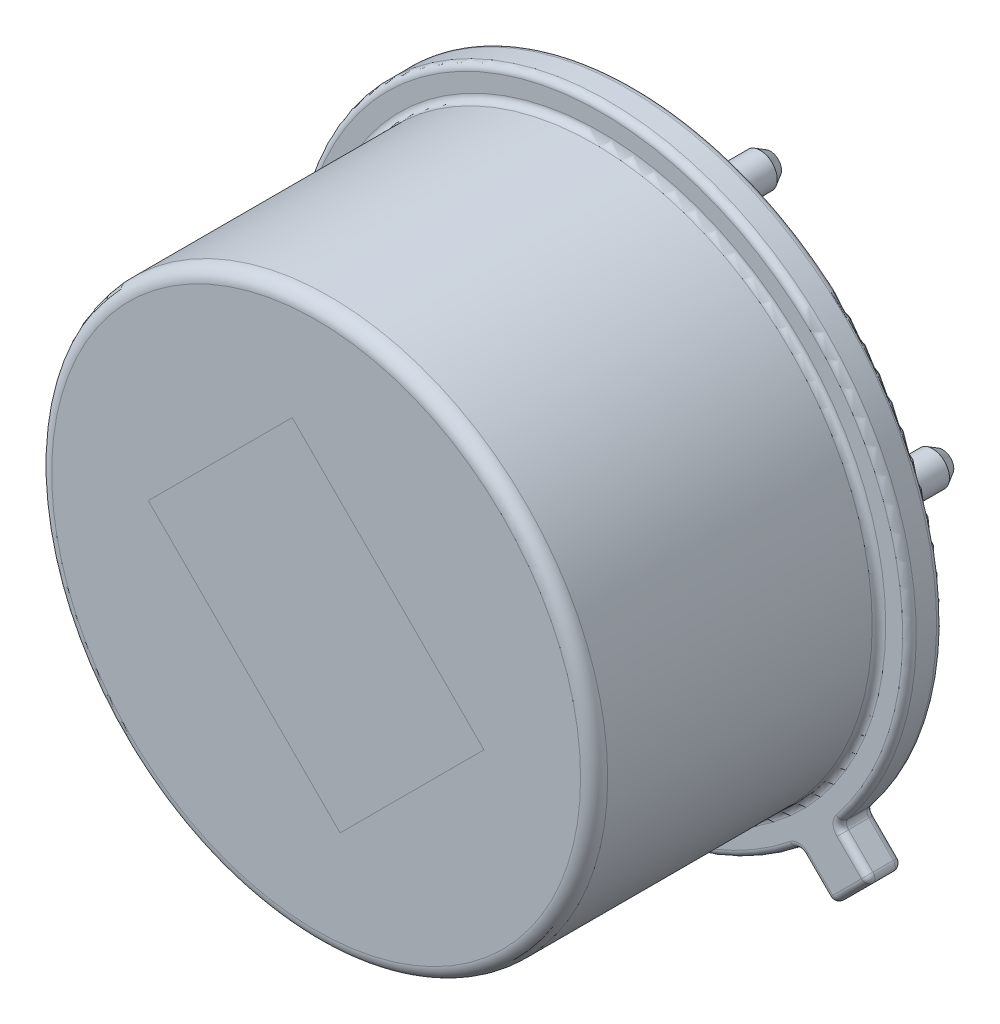
from build123d import *
from OCP.BRepFilletAPI import BRepFilletAPI_MakeChamfer

# Parameters (mm, degrees)
EXTRUDE1_DEPTH = 0.5
SKETCH2_R      = 4.1
EXTRUDE2_DEPTH = 4.2
EXTRUDE3_DEPTH = 0.9
SKETCH4_R      = 0.25
EXTRUDE4_DEPTH = 2
EXTRUDE5_DEPTH = 0.9
FILLET1_R      = 0.2
FILLET2_R      = 0.1
CHAMFER1_SIZE  = 0.15
CHAMFER1_SIZE2 = 0.08660254


with BuildPart() as part:
    # Sketch1 → Extrude1 (new body)
    with BuildSketch(Plane.XY):
        with BuildLine():
            Line((3.982696552, -3.417011127), (3.417011127, -3.982696552))
            Line((3.417011127, -3.982696552), (2.92203638, -3.487721805))
            ThreePointArc((2.92203638, -3.487721805), (-3.217335854, 3.217335854), (3.487721805, -2.92203638))
            Line((3.487721805, -2.92203638), (3.982696552, -3.417011127))
        make_face()
    extrude(amount=EXTRUDE1_DEPTH)

    # Sketch2 → Extrude2 (add)
    with BuildSketch(Plane.XY.offset(0.5)):
        Circle(SKETCH2_R)
    extrude(amount=EXTRUDE2_DEPTH)

    # Sketch3 → Extrude3 (cut)
    with BuildSketch(Plane.XY.offset(4.7)):
        Polygon((-2.474873734, 0.353553391), (0.353553391, -2.474873734), (2.474873734, -0.353553391), (-0.353553391, 2.474873734), align=None)
    extrude(amount=-EXTRUDE3_DEPTH, mode=Mode.SUBTRACT)

    # Sketch4 → Extrude4 (add)
    with BuildSketch(Plane(origin=(0, 0, 0), x_dir=(-1, 0, 0), z_dir=(0, 0, -1))):
        with Locations((-2.54, 0)):
            Circle(SKETCH4_R)
        with Locations((0, 2.54)):
            Circle(SKETCH4_R)
        with Locations((2.54, 0)):
            Circle(SKETCH4_R)
    extrude(amount=EXTRUDE4_DEPTH)

    # Fillet1
    fillet1_edges = [part.edges().sort_by_distance(p)[0] for p in [
        (-4.1, 0, 4.7),
    ]]
    fillet(fillet1_edges, radius=FILLET1_R)

    # Fillet2
    fillet2_edges = [part.edges().sort_by_distance(p)[0] for p in [
        (-2.29, 0, 0),
        (2.79, 0, 0),
        (-3.217335854, 3.217335854, 0),
        (3.169523754, -3.735209179, 0),
        (3.69985384, -3.69985384, 0),
        (3.735209179, -3.169523754, 0),
        (0.25, 2.54, 0),
        (-4.1, 0, 0.5),
        (3.69985384, -3.69985384, 0.5),
        (3.169523754, -3.735209179, 0.5),
        (-3.217335854, 3.217335854, 0.5),
        (3.735209179, -3.169523754, 0.5),
        (2.92203638, -3.487721805, 0.25),
        (3.417011127, -3.982696552, 0.25),
        (3.982696552, -3.417011127, 0.25),
        (3.487721805, -2.92203638, 0.25),
    ]]
    fillet(fillet2_edges, radius=FILLET2_R)

    # Chamfer1: one chamfer whose edges measure the first distance from different faces: ONE call of the kernel's chamfer builder (chamfer() names one face for all edges)
    chamfer1_edges_1 = [part.edges().sort_by_distance(p)[0] for p in [
        (-2.29, 0, -2),
    ]]
    chamfer1_side_1 = [part.faces().sort_by_distance(p)[0] for p in [
        (-2.29, 0, -1.05),
    ]]
    chamfer1_edges_2 = [part.edges().sort_by_distance(p)[0] for p in [
        (0.25, 2.54, -2),
    ]]
    chamfer1_side_2 = [part.faces().sort_by_distance(p)[0] for p in [
        (0.25, 2.54, -1.05),
    ]]
    chamfer1_edges_3 = [part.edges().sort_by_distance(p)[0] for p in [
        (2.79, 0, -2),
    ]]
    chamfer1_side_3 = [part.faces().sort_by_distance(p)[0] for p in [
        (2.79, 0, -1.05),
    ]]
    chamfer1 = BRepFilletAPI_MakeChamfer(part.part.solid().wrapped)
    for e in chamfer1_edges_1:
        chamfer1.Add(CHAMFER1_SIZE, CHAMFER1_SIZE2, e.wrapped, chamfer1_side_1[0].wrapped)  # the first distance lies on this face
    for e in chamfer1_edges_2:
        chamfer1.Add(CHAMFER1_SIZE, CHAMFER1_SIZE2, e.wrapped, chamfer1_side_2[0].wrapped)  # the first distance lies on this face
    for e in chamfer1_edges_3:
        chamfer1.Add(CHAMFER1_SIZE, CHAMFER1_SIZE2, e.wrapped, chamfer1_side_3[0].wrapped)  # the first distance lies on this face
    add(Compound.cast(chamfer1.Shape()), mode=Mode.REPLACE)


with BuildPart() as body_2:
    # Sketch5 → Extrude5 (new body)
    with BuildSketch(Plane.XY.offset(3.8)):
        Polygon((-0.353553391, 2.474873734), (2.474873734, -0.353553391), (0.353553391, -2.474873734), (-2.474873734, 0.353553391), align=None)
    extrude(amount=EXTRUDE5_DEPTH)


solid = Compound([part.part, body_2.part])
